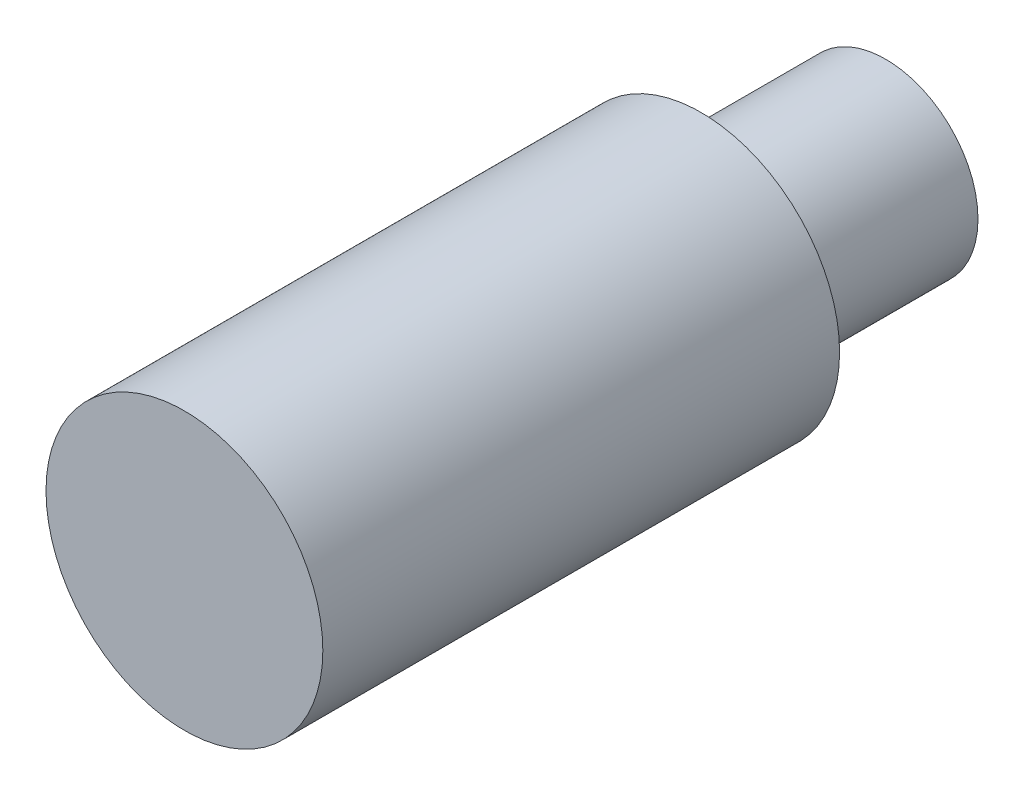
from build123d import *

# Parameters (mm, degrees)
SKETCH1_R           = 5
BOSS_EXTRUDE1_DEPTH = 10
SKETCH2_R           = 7.5
BOSS_EXTRUDE2_DEPTH = 28


with BuildPart() as part:
    # Sketch1 → Boss-Extrude1 (new body)
    with BuildSketch(Plane.XY):
        Circle(SKETCH1_R)
    extrude(amount=BOSS_EXTRUDE1_DEPTH)

    # Sketch2 → Boss-Extrude2 (add)
    with BuildSketch(Plane.XY.offset(10)):
        Circle(SKETCH2_R)
    extrude(amount=BOSS_EXTRUDE2_DEPTH)


solid = part.part
